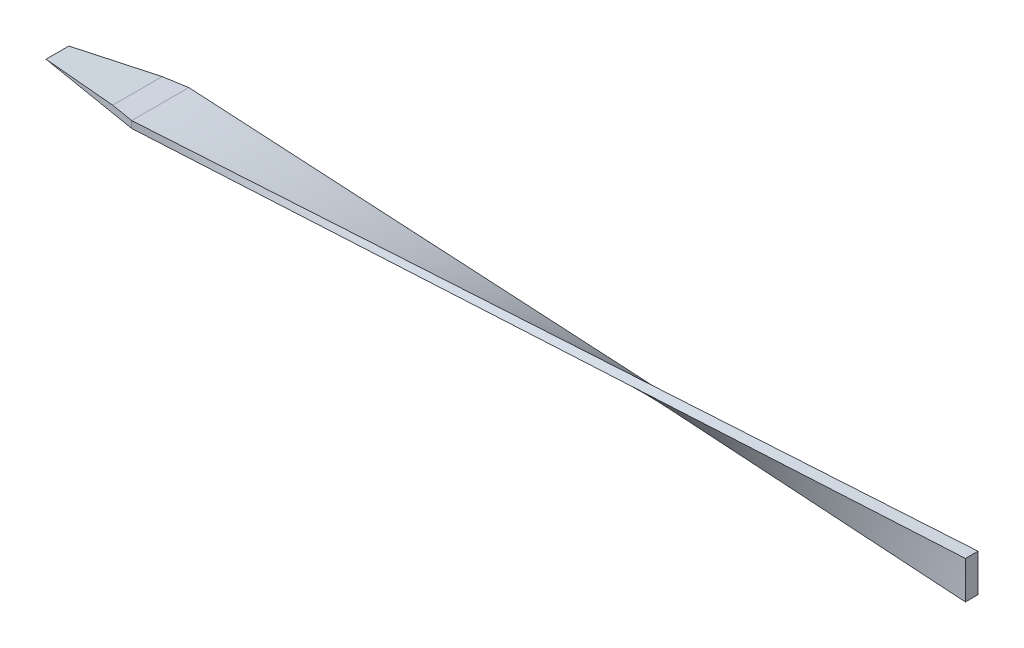
from build123d import *

# Parameters (mm, degrees)
BOSS_EXTRUDE1_DEPTH = 0.06
CUT_EXTRUDE3_DEPTH  = 9.09728967
CUT_EXTRUDE4_DEPTH  = 9.09728967
CUT_EXTRUDE5_DEPTH  = 2.5
SKETCH7_W           = 7.1
SKETCH7_H           = 0.5
CUT_EXTRUDE6_DEPTH  = 2.5


with BuildPart() as part:
    # Sketch1 → Boss-Extrude1 (new body)
    with BuildSketch(Plane(origin=(0, 0, 0), x_dir=(1, 0, 0), z_dir=(0, 1, 0))):
        with BuildLine():
            ThreePointArc((-0.362264151, -0.932075472), (-0.747576714, -0.664175471), (-0.968245837, -0.25))
            Line((-0.968245837, -0.25), (-4, -0.25))
            Line((-4, -0.25), (-0.362264151, -0.932075472))
        make_face()
        with BuildLine():
            ThreePointArc((-0.968245837, 0.25), (-0.747576714, 0.664175471), (-0.362264151, 0.932075472))
            Line((-0.362264151, 0.932075472), (-4, 0.25))
            Line((-4, 0.25), (-0.968245837, 0.25))
        make_face()
        with BuildLine():
            ThreePointArc((-0.968245837, -0.25), (-1, 0), (-0.968245837, 0.25))
            Line((-0.968245837, 0.25), (-4, 0.25))
            Line((-4, 0.25), (-8, 0.25))
            Line((-8, 0.25), (-8, -0.25))
            Line((-8, -0.25), (-4, -0.25))
            Line((-4, -0.25), (-0.968245837, -0.25))
        make_face()
        with BuildLine():
            Line((0, -1), (0, -0.25))
            Line((0, -0.25), (-0.968245837, -0.25))
            ThreePointArc((-0.968245837, -0.25), (-0.747576714, -0.664175471), (-0.362264151, -0.932075472))
            Line((-0.362264151, -0.932075472), (0, -1))
        make_face()
        with BuildLine():
            Line((0, 0.25), (0, 1))
            Line((0, 1), (-0.362264151, 0.932075472))
            ThreePointArc((-0.362264151, 0.932075472), (-0.747576714, 0.664175471), (-0.968245837, 0.25))
            Line((-0.968245837, 0.25), (0, 0.25))
        make_face()
        with BuildLine():
            Line((0, -0.25), (0, 0.25))
            Line((0, 0.25), (-0.968245837, 0.25))
            ThreePointArc((-0.968245837, 0.25), (-1, 0), (-0.968245837, -0.25))
            Line((-0.968245837, -0.25), (0, -0.25))
        make_face()
    extrude(amount=BOSS_EXTRUDE1_DEPTH)

    # Sketch5 → Cut-Extrude3 (cut, through all)
    with BuildSketch(Plane.XY.offset(0.25)):
        Polygon((-8, 0), (-8, 0.06), (-7.3, 0.06), align=None)
    extrude(amount=-CUT_EXTRUDE3_DEPTH, mode=Mode.SUBTRACT)

    # 3DSketch1 → Cut-Extrude4 (cut, through all)
    with BuildSketch(Plane(origin=(-8, 0.06, 0.25), x_dir=(0.8741572761215382, 0, -0.48564293117863155), z_dir=(0, 1, 0))):
        Polygon((0, 0), (0.07284644, 0.131123591), (0.786741549, -0.437078638), align=None)
        Polygon((1.029563014, 0), (0.242821466, 0.437078638), (0.169975026, 0.305955047), align=None)
    extrude(amount=-CUT_EXTRUDE4_DEPTH, mode=Mode.SUBTRACT)

    # Sketch6 → Cut-Extrude5 (cut)
    with BuildSketch(Plane(origin=(0, 0.06, 0), x_dir=(1, 0, 0), z_dir=(0, 1, 0))):
        Polygon((0, 1), (-4, 0.25), (0, 0.25), align=None)
        Polygon((0, -0.25), (-4, -0.25), (0, -1), align=None)
    extrude(amount=-CUT_EXTRUDE5_DEPTH, mode=Mode.SUBTRACT)

    # Sketch7 → Cut-Extrude6 (cut)
    with BuildSketch(Plane(origin=(0, 0.06, 0), x_dir=(1, 0, 0), z_dir=(0, 1, 0))):
        with Locations((-3.55, 0)):
            Rectangle(SKETCH7_W, SKETCH7_H)
    extrude(amount=-CUT_EXTRUDE6_DEPTH, mode=Mode.SUBTRACT)

    # Loft1: read off the stored shape, not the designer's step
    # Loft1: loft between two sections, ruled curve by curve
    loft1_from = [
        Edge.make_bspline([(-7.1, 0.06, 0.25), (-7.1, 0.05, 0.25), (-7.1, 0.04, 0.25), (-7.1, 0.02, 0.25), (-7.1, 0.01, 0.25), (-7.1, 0, 0.25)], [0, 0, 0, 0, 0.5, 0.5, 1, 1, 1, 1], 3),
        Edge.make_bspline([(-7.1, 0, 0.25), (-7.1, 0, 0.166666667), (-7.1, 0, 0.083333333), (-7.1, 0, -0.083333333), (-7.1, 0, -0.166666667), (-7.1, 0, -0.25)], [0, 0, 0, 0, 0.5, 0.5, 1, 1, 1, 1], 3),
        Edge.make_bspline([(-7.1, 0.06, -0.25), (-7.1, 0.06, -0.166666667), (-7.1, 0.06, -0.083333333), (-7.1, 0.06, 0.083333333), (-7.1, 0.06, 0.166666667), (-7.1, 0.06, 0.25)], [0, 0, 0, 0, 0.5, 0.5, 1, 1, 1, 1], 3),
        Edge.make_bspline([(-7.1, 0, -0.25), (-7.1, 0.01, -0.25), (-7.1, 0.02, -0.25), (-7.1, 0.04, -0.25), (-7.1, 0.05, -0.25), (-7.1, 0.06, -0.25)], [0, 0, 0, 0, 0.5, 0.5, 1, 1, 1, 1], 3),
    ]
    loft1_to = [
        Edge.make_bspline([(0, 0.194939284, -0.054437375), (0, 0.194939593, -0.036104042), (0, 0.194939903, -0.017770708), (0, 0.194940522, 0.018895958), (0, 0.194940832, 0.037229292), (0, 0.194941141, 0.055562625)], [0, 0, 0, 0, 0.5, 0.5, 1, 1, 1, 1], 3),
        Edge.make_bspline([(0, 0.194941141, 0.055562625), (0, 0.139941141, 0.055563554), (0, 0.084941141, 0.055564483), (0, -0.025058859, 0.05556634), (0, -0.080058859, 0.055567269), (0, -0.135058859, 0.055568198)], [0, 0, 0, 0, 0.5, 0.5, 1, 1, 1, 1], 3),
        Edge.make_bspline([(0, -0.135060716, -0.054431802), (0, -0.080060716, -0.054432731), (0, -0.025060716, -0.05443366), (0, 0.084939284, -0.054435517), (0, 0.139939284, -0.054436446), (0, 0.194939284, -0.054437375)], [0, 0, 0, 0, 0.5, 0.5, 1, 1, 1, 1], 3),
        Edge.make_bspline([(0, -0.135058859, 0.055568198), (0, -0.135059168, 0.037234864), (0, -0.135059478, 0.018901531), (0, -0.135060097, -0.017765136), (0, -0.135060407, -0.036098469), (0, -0.135060716, -0.054431802)], [0, 0, 0, 0, 0.5, 0.5, 1, 1, 1, 1], 3),
    ]
    loft1 = Solid(Shell([*[Face.make_surface_from_curves(loft1_from[k], loft1_to[k]) for k in range(4)], Face(Wire(loft1_from)), Face(Wire(loft1_to))]))
    add(loft1)


solid = part.part
